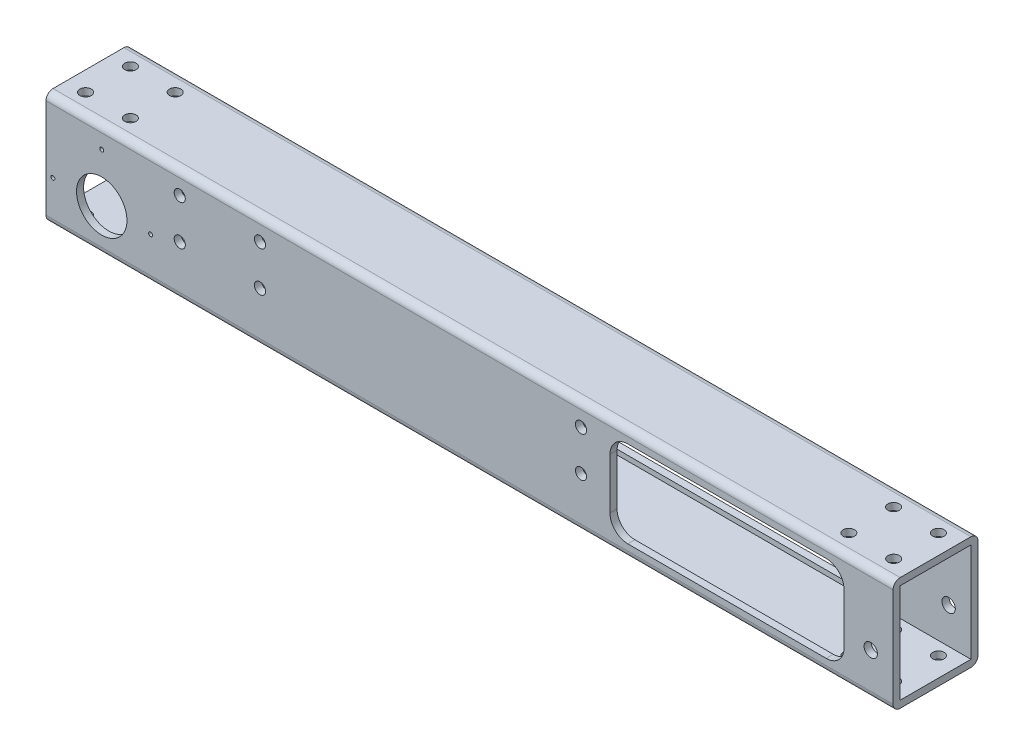
from build123d import *

# Parameters (mm, degrees)
MASTEREXTRUSION_EXTRUDE1_OUTLINE_W   = 44.45
MASTEREXTRUSION_EXTRUDE1_OUTLINE_H   = 31.75
MASTEREXTRUSION_EXTRUDE1_DEPTH       = 380
EXTRUDE1_DEPTH                       = 382.324091161
MASTEREXTRUSION_START                = 15.875
MASTEREXTRUSION_DEPTH                = 3.175
EXTRUDE3_DEPTH                       = 382.324091161
EXTRUDE3_DEPTH_BACK                  = 382.324091161
BUSHING_HOLES_MASTEREXTRUSION_2_R    = 3
EXTRUDE4_DEPTH                       = 382.324091161
EXTRUDE4_DEPTH_BACK                  = 382.324091161
MOTOR_MOUNTS_MASTEREXTRUSION_2_R     = 11.3109375
MOTOR_MOUNTS_MASTEREXTRUSION_2_R_2   = 0.889
EXTRUDE5_DEPTH                       = 382.324091161
EXTRUDE5_DEPTH_BACK                  = 382.324091161
SKETCH7_MASTEREXTRUSION_2_R          = 2.5527
Z_MOUNTING_HOLES_MASTEREXTRUSION_3_R = 2.5
EXTRUDE7_DEPTH                       = 382.324091161


# Read off the part's stored shape, not the designer's step: <MasterExtrusion>-<Extrude1>, MasterExtrusion
with BuildPart() as part:
    # <MasterExtrusion>-<Extrude1> outline → <MasterExtrusion>-<Extrude1> (new body)
    with BuildSketch(Plane.YZ):
        with BuildLine():
            ThreePointArc((25.4, 15.875), (24.47006403, 18.12006403), (22.225, 19.05))
            Line((22.225, 19.05), (-22.225, 19.05))
            ThreePointArc((-22.225, 19.05), (-24.47006403, 18.12006403), (-25.4, 15.875))
            Line((-25.4, 15.875), (-25.4, -15.875))
            ThreePointArc((-25.4, -15.875), (-24.47006403, -18.12006403), (-22.225, -19.05))
            Line((-22.225, -19.05), (22.225, -19.05))
            ThreePointArc((22.225, -19.05), (24.47006403, -18.12006403), (25.4, -15.875))
            Line((25.4, -15.875), (25.4, 15.875))
        make_face()
        Rectangle(MASTEREXTRUSION_EXTRUDE1_OUTLINE_W, MASTEREXTRUSION_EXTRUDE1_OUTLINE_H, mode=Mode.SUBTRACT)
    extrude(amount=MASTEREXTRUSION_EXTRUDE1_DEPTH)

    # Track-MasterExtrusion<2> → Extrude1 (cut, through all)
    with BuildSketch(Plane.XY):
        with BuildLine():
            Line((54, -3.96), (326, -3.96))
            ThreePointArc((326, -3.96), (334, -11.96), (326, -19.96))
            Line((326, -19.96), (54, -19.96))
            ThreePointArc((54, -19.96), (46, -11.96), (54, -3.96))
        make_face()
    extrude(amount=-EXTRUDE1_DEPTH, mode=Mode.SUBTRACT)

    # MasterExtrusion outline → MasterExtrusion (cut)
    with BuildSketch(Plane.XY.offset(MASTEREXTRUSION_START)):
        with BuildLine():
            ThreePointArc((261, 19.4), (255.343145751, 17.056854249), (253, 11.4))
            Line((253, 11.4), (253, -11.4))
            ThreePointArc((253, -11.4), (255.343145751, -17.056854249), (261, -19.4))
            Line((261, -19.4), (350, -19.4))
            ThreePointArc((350, -19.4), (355.656854249, -17.056854249), (358, -11.4))
            Line((358, -11.4), (358, 11.4))
            ThreePointArc((358, 11.4), (355.656854249, 17.056854249), (350, 19.4))
            Line((350, 19.4), (261, 19.4))
        make_face()
    extrude(amount=MASTEREXTRUSION_DEPTH, mode=Mode.SUBTRACT)

    # Bushing Holes-MasterExtrusion<2> → Extrude3 (cut, two sides: drawn at the far end of the back side and taken through both)
    with BuildSketch(Plane.XY.offset(-EXTRUDE3_DEPTH_BACK)):
        with Locations((25, -6.16)):
            Circle(BUSHING_HOLES_MASTEREXTRUSION_2_R)
        with Locations((370, -6.16)):
            Circle(BUSHING_HOLES_MASTEREXTRUSION_2_R)
    extrude(amount=EXTRUDE3_DEPTH + EXTRUDE3_DEPTH_BACK, mode=Mode.SUBTRACT)

    # Motor Mounts-MasterExtrusion<2> → Extrude4 (cut, two sides: drawn at the far end of the back side and taken through both)
    with BuildSketch(Plane.XY.offset(-EXTRUDE4_DEPTH_BACK)):
        with Locations((25, -6.16)):
            Circle(MOTOR_MOUNTS_MASTEREXTRUSION_2_R)
        with Locations((3.08, -6.16)):
            Circle(MOTOR_MOUNTS_MASTEREXTRUSION_2_R_2)
        with Locations((25, 15.76)):
            Circle(MOTOR_MOUNTS_MASTEREXTRUSION_2_R_2)
        with Locations((46.92, -6.16)):
            Circle(MOTOR_MOUNTS_MASTEREXTRUSION_2_R_2)
        with Locations((25, -28.08)):
            Circle(MOTOR_MOUNTS_MASTEREXTRUSION_2_R_2)
    extrude(amount=EXTRUDE4_DEPTH + EXTRUDE4_DEPTH_BACK, mode=Mode.SUBTRACT)

    # Sketch7-MasterExtrusion<2> → Extrude5 (cut, two sides: drawn at the far end of the back side and taken through both)
    with BuildSketch(Plane(origin=(0, 0, 0), x_dir=(1, 0, 0), z_dir=(0, 1, 0)).offset(-EXTRUDE5_DEPTH_BACK)):
        with Locations(Location((8.75, 10.05, 0), (0, 0, 90))):
            Circle(SKETCH7_MASTEREXTRUSION_2_R)
        with Locations(Location((28.85, 10.05, 0), (0, 0, 90))):
            Circle(SKETCH7_MASTEREXTRUSION_2_R)
        with Locations(Location((28.85, -10.05, 0), (0, 0, 90))):
            Circle(SKETCH7_MASTEREXTRUSION_2_R)
        with Locations(Location((8.75, -10.05, 0), (0, 0, 90))):
            Circle(SKETCH7_MASTEREXTRUSION_2_R)
        with Locations(Location((351.15, 10.05, 0), (0, 0, 90))):
            Circle(SKETCH7_MASTEREXTRUSION_2_R)
        with Locations(Location((371.25, 10.05, 0), (0, 0, 90))):
            Circle(SKETCH7_MASTEREXTRUSION_2_R)
        with Locations(Location((371.25, -10.05, 0), (0, 0, 90))):
            Circle(SKETCH7_MASTEREXTRUSION_2_R)
        with Locations(Location((351.15, -10.05, 0), (0, 0, 90))):
            Circle(SKETCH7_MASTEREXTRUSION_2_R)
    extrude(amount=EXTRUDE5_DEPTH + EXTRUDE5_DEPTH_BACK, mode=Mode.SUBTRACT)

    # z mounting holes-MasterExtrusion<3> → Extrude7 (cut, through all)
    with BuildSketch(Plane.XY):
        with Locations(Location((60, 15.4, 0), (0, 0, 180))):
            Circle(Z_MOUNTING_HOLES_MASTEREXTRUSION_3_R)
        with Locations(Location((240, 15.4, 0), (0, 0, 180))):
            Circle(Z_MOUNTING_HOLES_MASTEREXTRUSION_3_R)
        with Locations(Location((240, -2.6, 0), (0, 0, 180))):
            Circle(Z_MOUNTING_HOLES_MASTEREXTRUSION_3_R)
        with Locations(Location((60, -2.6, 0), (0, 0, 180))):
            Circle(Z_MOUNTING_HOLES_MASTEREXTRUSION_3_R)
        with Locations(Location((96, 15.4, 0), (0, 0, 180))):
            Circle(Z_MOUNTING_HOLES_MASTEREXTRUSION_3_R)
        with Locations(Location((96, -2.6, 0), (0, 0, 180))):
            Circle(Z_MOUNTING_HOLES_MASTEREXTRUSION_3_R)
    extrude(amount=EXTRUDE7_DEPTH, mode=Mode.SUBTRACT)


solid = part.part
